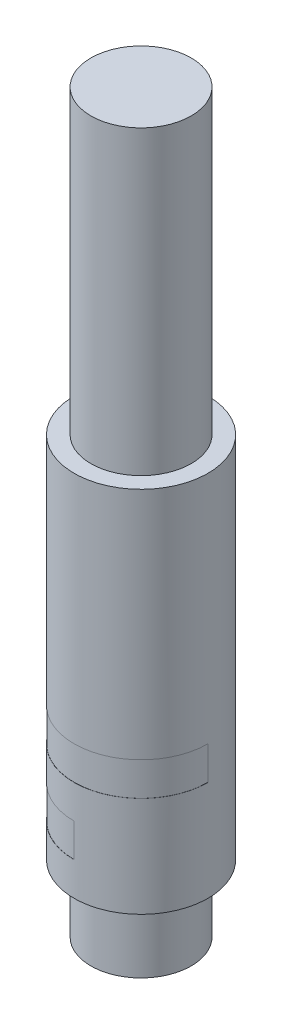
from build123d import *

# Parameters (mm, degrees)
SKETCH1_R           = 9.525
BOSS_EXTRUDE1_DEPTH = 57.15
SKETCH2_R           = 12.7
BOSS_EXTRUDE2_DEPTH = 69.85
BOSS_EXTRUDE3_START = 12.7
SKETCH3_R           = 9.525
BOSS_EXTRUDE3_DEPTH = 12.7
CUT_EXTRUDE1_START  = -6.35
CUT_EXTRUDE1_DEPTH  = 6.35
CUT_EXTRUDE2_START  = -6.35
CUT_EXTRUDE2_DEPTH  = 6.35


with BuildPart() as part:
    # Sketch1 → Boss-Extrude1 (new body)
    with BuildSketch(Plane(origin=(0, 0, 0), x_dir=(1, 0, 0), z_dir=(0, 1, 0))):
        Circle(SKETCH1_R)
    extrude(amount=BOSS_EXTRUDE1_DEPTH)

    # Sketch2 → Boss-Extrude2 (add)
    with BuildSketch(Plane.XZ):
        Circle(SKETCH2_R)
    extrude(amount=BOSS_EXTRUDE2_DEPTH)

    # Sketch3 → Boss-Extrude3 (add)
    with BuildSketch(Plane.XZ.offset(69.85).offset(BOSS_EXTRUDE3_START)):
        Circle(SKETCH3_R)
    extrude(amount=-BOSS_EXTRUDE3_DEPTH)

    # Sketch4 → Cut-Extrude1 (cut)
    with BuildSketch(Plane(origin=(0, -63.5, 0), x_dir=(-1, 0, 0), z_dir=(0, -1, 0)).offset(CUT_EXTRUDE1_START)):
        with BuildLine():
            Line((0, 12.7), (0, 12.6746))
            ThreePointArc((0, 12.6746), (12.6746, 0), (0, -12.6746))
            Line((0, -12.6746), (0, -12.7))
            ThreePointArc((0, -12.7), (12.7, 0), (0, 12.7))
        make_face()
    extrude(amount=CUT_EXTRUDE1_DEPTH, mode=Mode.SUBTRACT)

    # Sketch5 → Cut-Extrude2 (cut)
    with BuildSketch(Plane.XZ.offset(50.8).offset(CUT_EXTRUDE2_START)):
        with BuildLine():
            Line((-12.7, 0), (-12.6746, 0))
            ThreePointArc((-12.6746, 0), (0, 12.6746), (12.6746, 0))
            Line((12.6746, 0), (12.7, 0))
            ThreePointArc((12.7, 0), (0, 12.7), (-12.7, 0))
        make_face()
    extrude(amount=CUT_EXTRUDE2_DEPTH, mode=Mode.SUBTRACT)


solid = part.part
